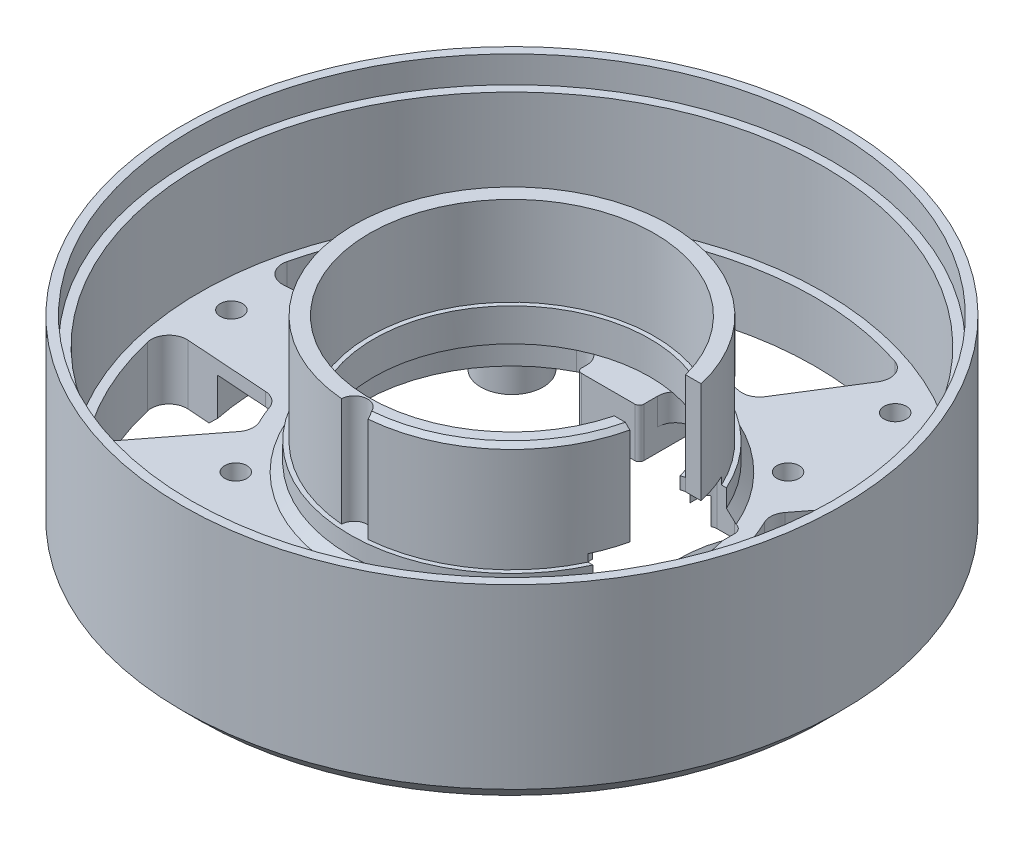
from build123d import *

# Parameters (mm, degrees)
CUT_EXTRUDE2_REACH              = 56.688
SKETCH2_R                       = 1.5000000000000016
CUT_EXTRUDE2_DIRECTION_2_REACH  = 56.688
BOSS_EXTRUDE1_START             = -10.7
SKETCH3_R                       = 3.4999999999999996
BOSS_EXTRUDE1_DEPTH             = 4
M3X0_5_TAPPED_HOLE1_D           = 2.5
M3X0_5_TAPPED_HOLE1_CSINK_D     = 3.2
M3X0_5_TAPPED_HOLE1_CSINK_ANGLE = 90
BOSS_EXTRUDE2_START             = -7.7
BOSS_EXTRUDE2_DEPTH             = 5.5
CUT_EXTRUDE5_DEPTH              = 55.68829856559812
CUT_EXTRUDE5_DEPTH_BACK         = 55.68829856559812
CHAMFER1_SIZE                   = 0.5
M3X0_5_TAPPED_HOLE2_D           = 2.5
M3X0_5_TAPPED_HOLE2_CSINK_D     = 3.2
M3X0_5_TAPPED_HOLE2_CSINK_ANGLE = 90
CIRPATTERN2_COUNT               = 6
CUT_EXTRUDE6_DEPTH              = 55.68829856559812
FILLET1_R                       = 2
CUT_EXTRUDE7_START              = -10.7
CUT_EXTRUDE7_DEPTH              = 5.319999999999999
CHAMFER2_SIZE                   = 1


with BuildPart() as part:
    # Sketch1 → Revolve1 (revolve)
    with BuildSketch(Plane.XY, mode=Mode.PRIVATE) as revolve1_sk:
        Polygon((-17.7, 5.999999999999998), (-17.7, -6.1999999999999975), (-18.2, -6.1999999999999975), (-18.200000000000003, -8.2), (-19.200000000000003, -9.200000000000001), (-35, -9.200000000000001), (-35, 2.9999999999999956), (-36, 2.9999999999999956), (-36, 5.999999999999996), (-37.00000000000001, 5.999999999999996), (-37, -13.9), (-35, -15.9), (-27.999999999999996, -15.9), (-27.999999999999996, -10.7), (-16.7, -10.7), (-16.7, -7.699999999999998), (-15.5, -7.699999999999998), (-15.5, -3.99999999999996), (-16, -3.99999999999996), (-16, 5.999999999999998), align=None)
    revolve(revolve1_sk.sketch.rotate(Axis((0, 0, 0), (0, -1, 0)), 270), axis=Axis((0, 0, 0), (0, -1, 0)))

    # Sketch2 → Cut-Extrude2 (cut, up to next)
    with BuildSketch(Plane(origin=(0, 0, 0), x_dir=(1, 0, 0), z_dir=(0, 1, 0)), mode=Mode.PRIVATE) as cut_extrude2_sk1:
        with Locations((0, -17.7)):
            Circle(SKETCH2_R)
    cut_extrude2_tool1 = extrude(cut_extrude2_sk1.sketch, amount=CUT_EXTRUDE2_REACH, mode=Mode.PRIVATE) & part.part
    add(cut_extrude2_tool1.solids().sort_by_distance((0, 0, 17.7))[0], mode=Mode.SUBTRACT)

    # Cut-Extrude2 direction 2: up to this face of the body (flat: up to its plane)
    cut_extrude2_direction_2_end = Plane(part.part.faces().sort_by_distance((0, -6.2, -17.751477374))[0])
    # Sketch2 → Cut-Extrude2 direction 2 (cut, up to the picked face)
    with BuildSketch(Plane(origin=(0, 0, 0), x_dir=(1, 0, 0), z_dir=(0, 1, 0)), mode=Mode.PRIVATE) as cut_extrude2_direction_2_sk1:
        with Locations((0, -17.7)):
            Circle(SKETCH2_R)
    cut_extrude2_direction_2_tool1 = split(extrude(cut_extrude2_direction_2_sk1.sketch, amount=-CUT_EXTRUDE2_DIRECTION_2_REACH, mode=Mode.PRIVATE), bisect_by=cut_extrude2_direction_2_end, keep=Keep.BOTH, mode=Mode.PRIVATE)
    add(cut_extrude2_direction_2_tool1.solids().sort_by(Axis((0, 0, 17.7), (0, -1, 0)))[0], mode=Mode.SUBTRACT)

    # Sketch3 → Boss-Extrude1 (add)
    with BuildSketch(Plane(origin=(0, 0, 0), x_dir=(1, 0, 0), z_dir=(0, 1, 0)).offset(BOSS_EXTRUDE1_START)):
        with Locations(Location((-15.49999999999999, -15.5, 0), (0, 0, 270))):
            Circle(SKETCH3_R)
        with Locations(Location((15.499999999999996, -15.499999999999993, 0), (0, 0, 270))):
            Circle(SKETCH3_R)
        with Locations(Location((15.5, 15.499999999999996, 0), (0, 0, 270))):
            Circle(SKETCH3_R)
        with Locations(Location((-15.5, 15.499999999999996, 0), (0, 0, 270))):
            Circle(SKETCH3_R)
    extrude(amount=-BOSS_EXTRUDE1_DEPTH)

    # M3x0.5 Tapped Hole1 (through all)
    with Locations(Plane(origin=(0, -14.700000000000001, 0), x_dir=(-1, 0, 0), z_dir=(0, -1, 0))):
        with Locations((-15.5, 15.5), (15.5, 15.5), (15.5, -15.5), (-15.5, -15.5)):
            CounterSinkHole(M3X0_5_TAPPED_HOLE1_D / 2, M3X0_5_TAPPED_HOLE1_CSINK_D / 2, counter_sink_angle=M3X0_5_TAPPED_HOLE1_CSINK_ANGLE)

    # Sketch7 → Boss-Extrude2 (add)
    with BuildSketch(Plane(origin=(0, 0, 0), x_dir=(1, 0, 0), z_dir=(0, 1, 0)).offset(BOSS_EXTRUDE2_START)):
        with BuildLine():
            Line((-4.1999999999999975, 12), (1.8000000000000016, 12))
            ThreePointArc((1.8000000000000016, 12), (2.1535533905932756, 12.146446609406727), (2.3000000000000025, 12.5))
            Line((2.3000000000000025, 12.5), (2.300000000000003, 18.5))
            ThreePointArc((2.300000000000003, 18.5), (2.153553390593277, 18.853553390593273), (1.800000000000003, 19))
            Line((1.800000000000003, 19), (-4.1999999999999975, 19))
            ThreePointArc((-4.1999999999999975, 19), (-4.5535533905932715, 18.853553390593273), (-4.6999999999999975, 18.5))
            Line((-4.6999999999999975, 18.5), (-4.6999999999999975, 12.5))
            ThreePointArc((-4.6999999999999975, 12.5), (-4.5535533905932715, 12.146446609406727), (-4.1999999999999975, 12))
        make_face()
    extrude(amount=-BOSS_EXTRUDE2_DEPTH)

    # Sketch10 → Cut-Extrude5 (cut, two sides: drawn at the far end of the back side and taken through both)
    with BuildSketch(Plane(origin=(0, 0, 0), x_dir=(1, 0, 0), z_dir=(0, 1, 0)).offset(-CUT_EXTRUDE5_DEPTH_BACK)):
        with BuildLine():
            Line((15.499999999999996, 3.999999999999999), (17.5, 3.9999999999999982))
            ThreePointArc((17.5, 3.9999999999999982), (18.207106781186546, 3.707106781186546), (18.5, 2.999999999999999))
            Line((18.5, 2.999999999999999), (18.5, -3.000000000000001))
            ThreePointArc((18.5, -3.000000000000001), (18.20710678118655, -3.707106781186549), (17.5, -4.000000000000002))
            Line((17.5, -4.000000000000002), (15.499999999999996, -4.000000000000001))
            ThreePointArc((15.499999999999996, -4.000000000000001), (14.792893218813449, -3.7071067811865483), (14.499999999999996, -3.000000000000001))
            Line((14.499999999999996, -3.000000000000001), (14.499999999999996, 2.999999999999999))
            ThreePointArc((14.499999999999996, 2.999999999999999), (14.792893218813449, 3.7071067811865466), (15.499999999999996, 3.999999999999999))
        make_face()
    extrude(amount=CUT_EXTRUDE5_DEPTH + CUT_EXTRUDE5_DEPTH_BACK, mode=Mode.SUBTRACT)

    # Chamfer1
    chamfer1_edges = [part.edges().sort_by_distance(p)[0] for p in [
        (11.588445930712233, 5.999999999999998, 13.379010460828525),
    ]]
    chamfer(chamfer1_edges, length=CHAMFER1_SIZE)

    # M3x0.5 Tapped Hole2 (through all)
    with Locations(Plane(origin=(0, -15.9, 0), x_dir=(-1, 0, 0), z_dir=(0, -1, 0))):
        with Locations((-31.5, 0)):
            m3x0_5_tapped_hole2 = CounterSinkHole(M3X0_5_TAPPED_HOLE2_D / 2, M3X0_5_TAPPED_HOLE2_CSINK_D / 2, counter_sink_angle=M3X0_5_TAPPED_HOLE2_CSINK_ANGLE)

    # CirPattern2: M3x0.5 Tapped Hole2 ×6 about axis
    cirpattern2_axis = Axis((-9.3e-16, 0, -3.728e-14), (0, 1, 0))
    for i in range(1, CIRPATTERN2_COUNT):
        add(m3x0_5_tapped_hole2.rotate(cirpattern2_axis, i * 360 / CIRPATTERN2_COUNT), mode=Mode.SUBTRACT)

    # Sketch13 → Cut-Extrude6 (cut, through all)
    with BuildSketch(Plane(origin=(0, 0, 0), x_dir=(1, 0, 0), z_dir=(0, 1, 0))):
        with BuildLine():
            Line((-11.773027420687583, 29.306703151937622), (-6.894494538528995, 21.545137951339427))
            ThreePointArc((-6.894494538528995, 21.545137951339427), (-5.964851777693605, 20.76098450867382), (-4.752825439264389, 20.660364235508567))
            ThreePointArc((-4.752825439264389, 20.660364235508567), (1.3e-15, 21.200000000000006), (4.752825439264389, 20.660364235508567))
            ThreePointArc((4.752825439264389, 20.660364235508567), (5.964851777693605, 20.76098450867382), (6.894494538528995, 21.545137951339427))
            Line((6.894494538528995, 21.545137951339427), (11.773027420687583, 29.306703151937622))
            ThreePointArc((11.773027420687583, 29.306703151937622), (11.96215934277389, 31.04666097841075), (10.7097217098344, 32.269209176828326))
            ThreePointArc((10.7097217098344, 32.269209176828326), (2.08e-15, 33.99999999999999), (-10.7097217098344, 32.269209176828326))
            ThreePointArc((-10.7097217098344, 32.269209176828326), (-11.96215934277389, 31.04666097841075), (-11.773027420687583, 29.306703151937622))
        make_face()
        with BuildLine():
            Line((11.77302742068759, -29.306703151937622), (6.894494538529, -21.545137951339427))
            ThreePointArc((6.894494538529, -21.545137951339427), (5.96485177769361, -20.76098450867382), (4.752825439264394, -20.660364235508567))
            ThreePointArc((4.752825439264394, -20.660364235508567), (1.3e-15, -21.200000000000006), (-4.752825439264394, -20.660364235508567))
            ThreePointArc((-4.752825439264394, -20.660364235508567), (-5.96485177769361, -20.76098450867382), (-6.894494538529, -21.545137951339427))
            Line((-6.894494538529, -21.545137951339427), (-11.77302742068759, -29.306703151937622))
            ThreePointArc((-11.77302742068759, -29.306703151937622), (-11.962159342773898, -31.04666097841075), (-10.709721709834408, -32.269209176828326))
            ThreePointArc((-10.709721709834408, -32.269209176828326), (2.08e-15, -34), (10.709721709834408, -32.269209176828326))
            ThreePointArc((10.709721709834408, -32.269209176828326), (11.962159342773898, -31.04666097841075), (11.77302742068759, -29.306703151937622))
        make_face()
        with BuildLine():
            Line((19.26644906790347, 11.399522324883955), (25.078575830648383, 18.920100507874288))
            ThreePointArc((25.078575830648383, 18.920100507874288), (26.733002594810113, 19.695809853045223), (28.3273840561073, 18.803172938038895))
            ThreePointArc((28.3273840561073, 18.803172938038895), (31.1952520838824, 13.522434966492932), (33.088650044367135, 7.819286300002263))
            ThreePointArc((33.088650044367135, 7.819286300002263), (32.667575875790234, 6.065725554517574), (31.006312684605312, 5.363953972618137))
            Line((31.006312684605312, 5.363953972618137), (21.642090677133144, 6.001944654745555))
            ThreePointArc((21.642090677133144, 6.001944654745555), (20.578126729623577, 6.397251564569373), (19.900619887313297, 7.3078949158202064))
            ThreePointArc((19.900619887313297, 7.3078949158202064), (19.50155312572882, 8.314410723820238), (19.051618120026195, 9.299239055357699))
            ThreePointArc((19.051618120026195, 9.299239055357699), (18.859321754192383, 10.380037211344689), (19.26644906790347, 11.399522324883955))
        make_face()
        with BuildLine():
            Line((31.006312684605312, -5.36395397261813), (21.642090677133144, -6.00194465474555))
            ThreePointArc((21.642090677133144, -6.00194465474555), (20.57812672962358, -6.397251564569369), (19.9006198873133, -7.307894915820201))
            ThreePointArc((19.9006198873133, -7.307894915820201), (19.501553125728822, -8.314410723820233), (19.0516181200262, -9.299239055357695))
            ThreePointArc((19.0516181200262, -9.299239055357695), (18.859321754192386, -10.380037211344685), (19.266449067903473, -11.399522324883952))
            Line((19.266449067903473, -11.399522324883952), (25.078575830648386, -18.92010050787428))
            ThreePointArc((25.078575830648386, -18.92010050787428), (26.733002594810117, -19.695809853045215), (28.327384056107302, -18.803172938038887))
            ThreePointArc((28.327384056107302, -18.803172938038887), (31.195252083882405, -13.522434966492925), (33.088650044367135, -7.819286300002256))
            ThreePointArc((33.088650044367135, -7.819286300002256), (32.667575875790234, -6.065725554517568), (31.006312684605312, -5.36395397261813))
        make_face()
        with BuildLine():
            Line((-19.266449067903466, -11.399522324883959), (-25.07857583064838, -18.920100507874295))
            ThreePointArc((-25.07857583064838, -18.920100507874295), (-26.73300259481011, -19.69580985304523), (-28.327384056107295, -18.8031729380389))
            ThreePointArc((-28.327384056107295, -18.8031729380389), (-31.195252083882405, -13.522434966492941), (-33.088650044367135, -7.819286300002269))
            ThreePointArc((-33.088650044367135, -7.819286300002269), (-32.667575875790234, -6.065725554517581), (-31.006312684605312, -5.363953972618144))
            Line((-31.006312684605312, -5.363953972618144), (-21.642090677133144, -6.00194465474556))
            ThreePointArc((-21.642090677133144, -6.00194465474556), (-20.578126729623577, -6.397251564569379), (-19.900619887313294, -7.307894915820212))
            ThreePointArc((-19.900619887313294, -7.307894915820212), (-19.50155312572881, -8.31441072382024), (-19.05161812002619, -9.299239055357702))
            ThreePointArc((-19.05161812002619, -9.299239055357702), (-18.85932175419238, -10.380037211344694), (-19.266449067903466, -11.399522324883959))
        make_face()
        with BuildLine():
            Line((-31.006312684605312, 5.363953972618137), (-21.642090677133144, 6.001944654745555))
            ThreePointArc((-21.642090677133144, 6.001944654745555), (-20.578126729623577, 6.397251564569373), (-19.900619887313297, 7.3078949158202064))
            ThreePointArc((-19.900619887313297, 7.3078949158202064), (-19.501553125728815, 8.314410723820242), (-19.051618120026195, 9.299239055357699))
            ThreePointArc((-19.051618120026195, 9.299239055357699), (-18.859321754192383, 10.38003721134469), (-19.26644906790347, 11.399522324883955))
            Line((-19.26644906790347, 11.399522324883955), (-25.078575830648383, 18.920100507874288))
            ThreePointArc((-25.078575830648383, 18.920100507874288), (-26.733002594810113, 19.695809853045223), (-28.3273840561073, 18.803172938038895))
            ThreePointArc((-28.3273840561073, 18.803172938038895), (-31.195252083882405, 13.522434966492925), (-33.088650044367135, 7.819286300002263))
            ThreePointArc((-33.088650044367135, 7.819286300002263), (-32.667575875790234, 6.065725554517574), (-31.006312684605312, 5.363953972618137))
        make_face()
    extrude(amount=-CUT_EXTRUDE6_DEPTH, mode=Mode.SUBTRACT)

    # Fillet1
    # the kernel refuses this fillet: 2 mm, written as the material it adds along each edge
    with BuildSketch(Plane(origin=(2.300000000000003, -10.7, -16.540858502508264), x_dir=(0.9764376402169549, 0, 0.21579975618045613), z_dir=(0, 1, 0))) as fillet1_piece_1:
        with BuildLine():
            CenterArc((2.4888855750797827, -1.9937073392295537), FILLET1_R, 85.45374567006199, 107.00870579100672)
            Line((0.536010294645873, -2.425306851590466), (0, 0))
            ThreePointArc((0, 0), (1.323706659357714, 0.05254371743322268), (2.647413318715439, 2e-17))
        make_face()
    extrude(amount=3)
    with BuildSketch(Plane(origin=(-4.6999999999999975, -10.7, -16.024980499208105), x_dir=(-0.9289347208682247, 0, 0.37024354736507337), z_dir=(0, 1, 0))) as fillet1_piece_2:
        with BuildLine():
            CenterArc((2.946621950049773, 1.9911743065349057), FILLET1_R, 158.26936173951248, 117.11528092219322)
            Line((1.088752508313324, 2.731661401265054), (0, 0))
            ThreePointArc((0, 0), (1.567152438402271, -0.07369454043352781), (3.134304876804534, -1.2e-16))
        make_face()
    extrude(amount=3)

    # Sketch14 → Cut-Extrude7 (cut)
    with BuildSketch(Plane(origin=(0, 0, 0), x_dir=(1, 0, 0), z_dir=(0, 1, 0)).offset(CUT_EXTRUDE7_START)):
        with BuildLine():
            Line((15.499999999999995, -7.5), (17.499999999999996, -7.5))
            ThreePointArc((17.499999999999996, -7.5), (18.207106781186543, -7.207106781186548), (18.5, -6.5))
            Line((18.5, -6.5), (18.5, 6.5))
            ThreePointArc((18.5, 6.5), (18.207106781186543, 7.207106781186548), (17.499999999999996, 7.5))
            Line((17.499999999999996, 7.5), (15.499999999999995, 7.5))
            ThreePointArc((15.499999999999995, 7.5), (14.792893218813447, 7.207106781186548), (14.499999999999995, 6.5))
            Line((14.499999999999995, 6.5), (14.499999999999995, -6.5))
            ThreePointArc((14.499999999999995, -6.5), (14.792893218813449, -7.207106781186547), (15.499999999999995, -7.5))
        make_face()
    extrude(amount=CUT_EXTRUDE7_DEPTH, mode=Mode.SUBTRACT)

    # Chamfer2
    chamfer2_edges = [part.edges().sort_by_distance(p)[0] for p in [
        (17.130543973511973, -15.9, 22.14823837625856),
        (27.999999999999996, -15.9, -1.136e-14),
        (17.130543973511976, -15.9, -22.148238376258558),
        (-17.13054397351197, -15.9, -22.148238376258565),
        (-27.999999999999996, -15.9, 7.93e-15),
        (-17.130543973511973, -15.9, 22.14823837625856),
    ]]
    chamfer(chamfer2_edges, length=CHAMFER2_SIZE)

    # Sketch16 → Cut-Revolve1 (revolve, cut)
    with BuildSketch(Plane.XY):
        Polygon((-17.7, -6.1999999999999975), (-18.2, -6.1999999999999975), (-18.200000000000003, -8.2), (-19.200000000000003, -9.200000000000001), (-23.33337257582576, -9.200000000000001), (-23.33337257582576, -3.0666274241742704), (-17.7, -3.066627424174271), align=None)
    revolve(axis=Axis((0, 0, 0), (0, 1, 0)), mode=Mode.SUBTRACT)


solid = part.part
